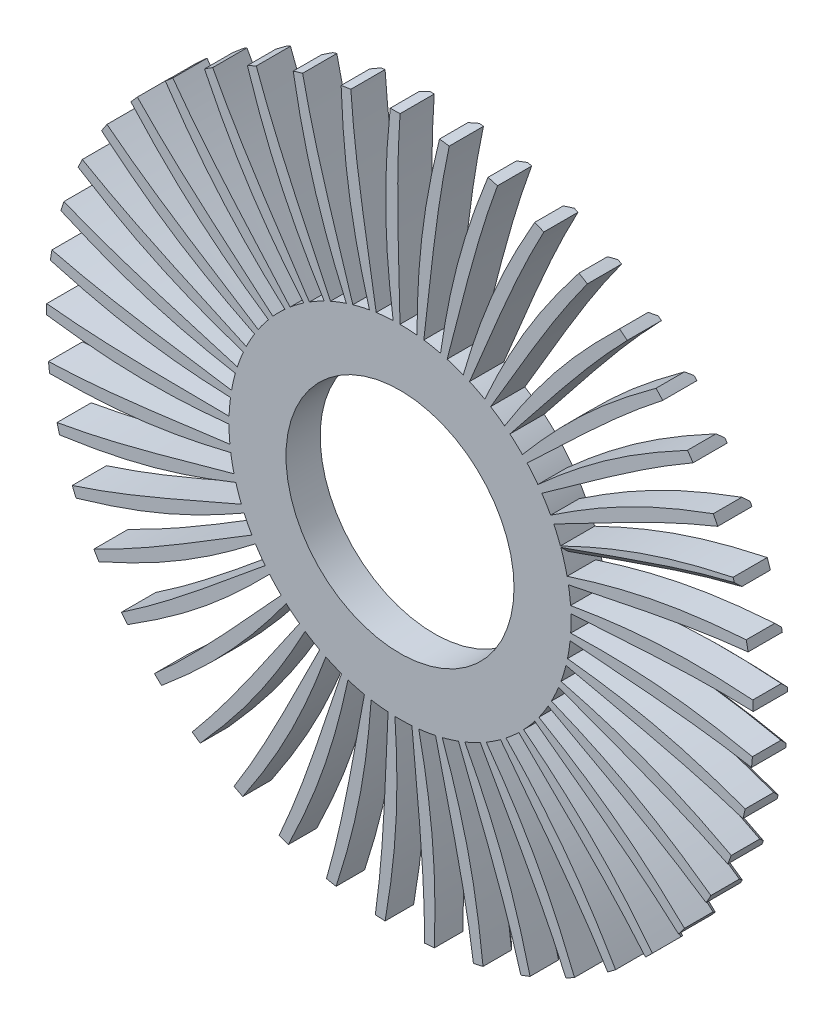
from build123d import *

# Parameters (mm, degrees)
BOSS_EXTRUDE1_DEPTH = 30
CHAMFER1_SIZE       = 5
SKETCH4_R           = 100
CUT_EXTRUDE4_DEPTH  = 30


with BuildPart() as part:
    # Sketch2 → Boss-Extrude1 (new body)
    with BuildSketch(Plane.XY):
        with BuildLine():
            ThreePointArc((-145.569699643, -273.695930817), (-141.749672317, -275.693725714), (-137.902233476, -277.638207029))
            add(Edge.make_bspline(
                [(-65.066689721, -135.152972179), (-87.040843165, -195.093671847), (-108.505576831, -233.805632242), (-137.902233476, -277.638207029)],
                knots=[0, 0, 0, 0, 0.636597092, 0.636597092, 0.636597092, 0.636597092], degree=3))
            ThreePointArc((-65.066689721, -135.152972179), (-58.257103372, -138.22485271), (-51.303021499, -140.953893118))
            add(Edge.make_bspline(
                [(-51.303021499, -140.953893118), (-68.971079254, -192.807719134), (-83.711324529, -241.446059466), (-106.06191392, -291.291727338)],
                knots=[0, 0, 0, 0, 0.656298971, 0.656298971, 0.656298971, 0.656298971], degree=3))
            ThreePointArc((-106.06191392, -291.291727338), (-102.001023527, -292.738434783), (-97.920408202, -294.128532546))
            add(Edge.make_bspline(
                [(-45.623806927, -142.893205722), (-59.041976374, -205.308777697), (-74.910153155, -246.631309501), (-97.920408202, -294.128532546)],
                knots=[0, 0, 0, 0, 0.636597092, 0.636597092, 0.636597092, 0.636597092], degree=3))
            ThreePointArc((-45.623806927, -142.893205722), (-38.452967865, -144.987479675), (-31.186753623, -146.72214011))
            add(Edge.make_bspline(
                [(-31.186753623, -146.72214011), (-41.46620929, -200.530246641), (-49.293854863, -250.746687633), (-64.489753687, -303.217861725)],
                knots=[0, 0, 0, 0, 0.656298971, 0.656298971, 0.656298971, 0.656298971], degree=3))
            ThreePointArc((-64.489753687, -303.217861725), (-60.267040839, -304.085323205), (-56.032673566, -304.893980743))
            add(Edge.make_bspline(
                [(-25.292908628, -147.852185554), (-29.893924672, -211.527781724), (-39.856688557, -254.656588858), (-56.032673566, -304.893980743)],
                knots=[0, 0, 0, 0, 0.636597092, 0.636597092, 0.636597092, 0.636597092], degree=3))
            ThreePointArc((-25.292908628, -147.852185554), (-17.900389078, -148.928090268), (-10.463471062, -149.634607539))
            add(Edge.make_bspline(
                [(-10.463471062, -149.634607539), (-13.154246731, -204.349680998), (-13.916936382, -255.166816745), (-21.662373755, -309.24220534)],
                knots=[0, 0, 0, 0, 0.656298971, 0.656298971, 0.656298971, 0.656298971], degree=3))
            ThreePointArc((-21.662373755, -309.24220534), (-17.360028754, -309.513536702), (-13.054326674, -309.725014416))
            add(Edge.make_bspline(
                [(-4.469712632, -149.933390774), (-0.164021731, -213.62963809), (-4.027458852, -257.725267381), (-13.054326674, -309.725014416)],
                knots=[0, 0, 0, 0, 0.636597092, 0.636597092, 0.636597092, 0.636597092], degree=3))
            ThreePointArc((-4.469712632, -149.933390774), (3.00060042, -149.969984987), (10.463471062, -149.634607539))
            add(Edge.make_bspline(
                [(10.463471062, -149.634607539), (15.413748279, -204.191681258), (21.730859434, -254.620414018), (21.586639642, -309.247501185)],
                knots=[0, 0, 0, 0, 0.656298971, 0.656298971, 0.656298971, 0.656298971], degree=3))
            ThreePointArc((21.586639642, -309.247501185), (25.884876545, -308.917421273), (30.178107837, -308.527602991))
            add(Edge.make_bspline(
                [(16.440481235, -149.096313089), (29.569073708, -211.57343655), (31.880160758, -255.777616733), (30.178107837, -308.527602991)],
                knots=[0, 0, 0, 0, 0.636597092, 0.636597092, 0.636597092, 0.636597092], degree=3))
            ThreePointArc((16.440481235, -149.096313089), (23.843186645, -148.092884537), (31.186753623, -146.72214011))
            add(Edge.make_bspline(
                [(31.186753623, -146.72214011), (43.681732211, -200.059322707), (56.955688791, -249.118114557), (64.415493653, -303.233646183)],
                knots=[0, 0, 0, 0, 0.656298971, 0.656298971, 0.656298971, 0.656298971], degree=3))
            ThreePointArc((64.415493653, -303.233646183), (68.625962165, -302.308579628), (72.823159806, -301.325052719))
            add(Edge.make_bspline(
                [(37.030679836, -145.357245264), (58.72664076, -205.399198729), (67.167269302, -248.851545718), (72.823159806, -301.325052719)],
                knots=[0, 0, 0, 0, 0.636597092, 0.636597092, 0.636597092, 0.636597092], degree=3))
            ThreePointArc((37.030679836, -145.357245264), (44.221692363, -143.333324543), (51.303021499, -140.953893118))
            add(Edge.make_bspline(
                [(51.303021499, -140.953893118), (71.099500913, -192.033037004), (91.071940451, -238.767014365), (105.990573352, -291.317693181)],
                knots=[0, 0, 0, 0, 0.656298971, 0.656298971, 0.656298971, 0.656298971], degree=3))
            ThreePointArc((105.990573352, -291.317693181), (110.031321492, -289.815645352), (114.050791804, -288.257553047))
            add(Edge.make_bspline(
                [(56.900118376, -138.788964002), (86.741160551, -195.227099143), (101.14704335, -237.08186243), (114.050791804, -288.257553047)],
                knots=[0, 0, 0, 0, 0.636597092, 0.636597092, 0.636597092, 0.636597092], degree=3))
            ThreePointArc((56.900118376, -138.788964002), (63.73947314, -135.783944426), (70.420734418, -132.442138929))
            add(Edge.make_bspline(
                [(70.420734418, -132.442138929), (97.133398704, -180.26904667), (123.415580383, -223.768585831), (145.502667102, -273.731572651)],
                knots=[0, 0, 0, 0, 0.656298971, 0.656298971, 0.656298971, 0.656298971], degree=3))
            ThreePointArc((145.502667102, -273.731572651), (149.295046306, -271.681779199), (153.058554871, -269.579447994))
            add(Edge.make_bspline(
                [(75.662060835, -129.519313426), (113.067362319, -181.255126139), (133.158105253, -220.697650366), (153.058554871, -269.579447994)],
                knots=[0, 0, 0, 0, 0.636597092, 0.636597092, 0.636597092, 0.636597092], degree=3))
            ThreePointArc((75.662060835, -129.519313426), (82.016637575, -125.591684282), (88.167787844, -121.352549156))
            add(Edge.make_bspline(
                [(88.167787844, -121.352549156), (121.276705377, -164.996324395), (153.357076426, -204.414756308), (182.182716945, -250.817578424)],
                knots=[0, 0, 0, 0, 0.656298971, 0.656298971, 0.656298971, 0.656298971], degree=3))
            ThreePointArc((182.182716945, -250.817578424), (185.652912863, -248.259936247), (189.087207269, -245.654285628))
            add(Edge.make_bspline(
                [(92.951327344, -117.728716739), (137.192836491, -163.75522828), (162.577396102, -200.017809578), (189.087207269, -245.654285628)],
                knots=[0, 0, 0, 0, 0.636597092, 0.636597092, 0.636597092, 0.636597092], degree=3))
            ThreePointArc((92.951327344, -117.728716739), (98.697441453, -112.954924862), (104.198755569, -107.900970051))
            add(Edge.make_bspline(
                [(104.198755569, -107.900970051), (143.05949893, -146.512136346), (180.313651418, -181.082226071), (215.316787432, -223.021705334)],
                knots=[0, 0, 0, 0, 0.656298971, 0.656298971, 0.656298971, 0.656298971], degree=3))
            ThreePointArc((215.316787432, -223.021705334), (218.397256649, -220.005996028), (221.435492261, -216.947742019))
            add(Edge.make_bspline(
                [(108.431401996, -103.646664496), (158.648008155, -143.068021171), (188.832302865, -175.444849643), (221.435492261, -216.947742019)],
                knots=[0, 0, 0, 0, 0.636597092, 0.636597092, 0.636597092, 0.636597092], degree=3))
            ThreePointArc((108.431401996, -103.646664496), (113.457211899, -98.119626314), (118.201613041, -92.349221299))
            add(Edge.make_bspline(
                [(118.201613041, -92.349221299), (162.057802065, -125.176256219), (203.760626288, -154.225136281), (244.25996157, -190.884968433)],
                knots=[0, 0, 0, 0, 0.656298971, 0.656298971, 0.656298971, 0.656298971], degree=3))
            ThreePointArc((244.25996157, -190.884968433), (246.890746257, -187.469889349), (249.473787275, -184.018557386))
            add(Edge.make_bspline(
                [(121.800982748, -87.547247825), (177.0152768, -119.596157768), (211.411803647, -147.457055275), (249.473787275, -184.018557386)],
                knots=[0, 0, 0, 0, 0.636597092, 0.636597092, 0.636597092, 0.636597092], degree=3))
            ThreePointArc((121.800982748, -87.547247825), (126.008666771, -81.37454085), (129.903810568, -75))
            add(Edge.make_bspline(
                [(129.903810568, -75), (177.90183442, -101.40396265), (223.241632342, -124.366229642), (268.448893399, -155.03287275)],
                knots=[0, 0, 0, 0, 0.656298971, 0.656298971, 0.656298971, 0.656298971], degree=3))
            ThreePointArc((268.448893399, -155.03287275), (270.578788324, -151.284894518), (272.656358792, -147.507660852))
            add(Edge.make_bspline(
                [(132.799845917, -69.743823558), (191.937144434, -93.796491192), (229.876414148, -116.599177057), (272.656358792, -147.507660852)],
                knots=[0, 0, 0, 0, 0.636597092, 0.636597092, 0.636597092, 0.636597092], degree=3))
            ThreePointArc((132.799845917, -69.743823558), (136.107506278, -63.04559251), (139.077578185, -56.190989012))
            add(Edge.make_bspline(
                [(139.077578185, -56.190989012), (190.283209928, -75.657956294), (238.377493956, -92.086675808), (287.412772873, -116.163238546)],
                knots=[0, 0, 0, 0, 0.656298971, 0.656298971, 0.656298971, 0.656298971], degree=3))
            ThreePointArc((287.412772873, -116.163238546), (289.000322054, -112.155311299), (290.531984428, -108.125695487))
            add(Edge.make_bspline(
                [(141.213911143, -50.582915098), (203.123173877, -66.171182608), (243.866741728, -83.471828486), (290.531984428, -108.125695487)],
                knots=[0, 0, 0, 0, 0.636597092, 0.636597092, 0.636597092, 0.636597092], degree=3))
            ThreePointArc((141.213911143, -50.582915098), (143.557167994, -43.489533425), (145.544358941, -36.28828434))
            add(Edge.make_bspline(
                [(145.544358941, -36.28828434), (198.960939199, -48.439353878), (248.873608801, -58.014759576), (300.782489651, -75.032619037)],
                knots=[0, 0, 0, 0, 0.656298971, 0.656298971, 0.656298971, 0.656298971], degree=3))
            ThreePointArc((300.782489651, -75.032619037), (301.796793249, -70.842752521), (302.752735461, -66.63918645))
            add(Edge.make_bspline(
                [(146.879408216, -30.437467733), (210.355641789, -37.257927222), (253.110480574, -48.719795722), (302.752735461, -66.63918645)],
                knots=[0, 0, 0, 0, 0.636597092, 0.636597092, 0.636597092, 0.636597092], degree=3))
            ThreePointArc((146.879408216, -30.437467733), (148.21265273, -23.08700004), (149.178284305, -15.67926949))
            add(Edge.make_bspline(
                [(149.178284305, -15.67926949), (203.766120103, -20.277934537), (254.525681941, -22.813652028), (308.297817404, -32.441574927)],
                knots=[0, 0, 0, 0, 0.656298971, 0.656298971, 0.656298971, 0.656298971], degree=3))
            ThreePointArc((308.297817404, -32.441574927), (308.719133153, -28.151320136), (309.080748875, -23.855621451))
            add(Edge.make_bspline(
                [(149.686064682, -9.699589681), (213.49377641, -7.619488663), (257.427711825, -13.019487551), (309.080748875, -23.855621451)],
                knots=[0, 0, 0, 0, 0.636597092, 0.636597092, 0.636597092, 0.636597092], degree=3))
            ThreePointArc((149.686064682, -9.699589681), (149.983346769, -2.235104461), (149.908624053, 5.234924505))
            add(Edge.make_bspline(
                [(149.908624053, 5.234924505), (204.60522526, 8.278171733), (255.223702198, 12.831497295), (309.812478821, 10.780907518)],
                knots=[0, 0, 0, 0, 0.656298971, 0.656298971, 0.656298971, 0.656298971], degree=3))
            ThreePointArc((309.812478821, 10.780907518), (309.63260629, 15.088045663), (309.392857086, 19.392266086))
            add(Edge.make_bspline(
                [(149.579252164, 11.227079851), (212.476497519, 22.167254576), (256.734405485, 22.934230134), (309.392857086, 19.392266086)],
                knots=[0, 0, 0, 0, 0.636597092, 0.636597092, 0.636597092, 0.636597092], degree=3))
            ThreePointArc((149.579252164, 11.227079851), (148.834785567, 18.660294884), (147.721162952, 26.04722665))
            add(Edge.make_bspline(
                [(147.721162952, 26.04722665), (201.461922442, 36.673152807), (250.954083404, 48.226896119), (305.296992744, 53.79355186)],
                knots=[0, 0, 0, 0, 0.656298971, 0.656298971, 0.656298971, 0.656298971], degree=3))
            ThreePointArc((305.296992744, 53.79355186), (304.519432948, 58.033739815), (303.682985264, 62.262705221))
            add(Edge.make_bspline(
                [(146.561049647, 31.935227045), (207.323605292, 51.522537419), (251.044055973, 58.441559118), (303.682985264, 62.262705221)],
                knots=[0, 0, 0, 0, 0.636597092, 0.636597092, 0.636597092, 0.636597092], degree=3))
            ThreePointArc((146.561049647, 31.935227045), (144.789324561, 39.192492815), (142.658477444, 46.352549156))
            add(Edge.make_bspline(
                [(142.658477444, 46.352549156), (194.397392464, 64.354332676), (241.799928833, 82.683613267), (294.839247972, 95.759165907)],
                knots=[0, 0, 0, 0, 0.656298971, 0.656298971, 0.656298971, 0.656298971], degree=3))
            ThreePointArc((294.839247972, 95.759165907), (293.479135229, 99.849873235), (292.062269567, 103.921271621))
            add(Edge.make_bspline(
                [(140.690203009, 52.02179137), (198.135394915, 79.874992677), (240.46741947, 92.811389629), (292.062269567, 103.921271621)],
                knots=[0, 0, 0, 0, 0.636597092, 0.636597092, 0.636597092, 0.636597092], degree=3))
            ThreePointArc((140.690203009, 52.02179137), (137.925704048, 58.961853455), (134.819106945, 65.755672018))
            add(Edge.make_bspline(
                [(134.819106945, 65.755672018), (183.549138365, 90.782928662), (227.93941369, 115.530987935), (278.642792614, 135.860936712)],
                knots=[0, 0, 0, 0, 0.656298971, 0.656298971, 0.656298971, 0.656298971], degree=3))
            ThreePointArc((278.642792614, 135.860936712), (276.726599971, 139.72254245), (274.756894009, 143.557128679))
            add(Edge.make_bspline(
                [(132.080981602, 71.0958107), (185.090704452, 106.672772059), (225.210358175, 125.374752013), (274.756894009, 143.557128679)],
                knots=[0, 0, 0, 0, 0.636597092, 0.636597092, 0.636597092, 0.636597092], degree=3))
            ThreePointArc((132.080981602, 71.0958107), (128.377516594, 77.583588684), (124.355635883, 83.878935521))
            add(Edge.make_bspline(
                [(124.355635883, 83.878935521), (169.128309071, 115.444538206), (209.642317137, 146.129683336), (257.022872249, 173.318328924)],
                knots=[0, 0, 0, 0, 0.656298971, 0.656298971, 0.656298971, 0.656298971], degree=3))
            ThreePointArc((257.022872249, 173.318328924), (254.587896216, 176.875671308), (252.103688041, 180.39880952))
            add(Edge.make_bspline(
                [(120.900954128, 88.786030945), (168.443433964, 131.394287272), (205.569833431, 155.49783746), (252.103688041, 180.39880952)],
                knots=[0, 0, 0, 0, 0.636597092, 0.636597092, 0.636597092, 0.636597092], degree=3))
            ThreePointArc((120.900954128, 88.786030945), (116.330606807, 94.69524761), (111.471723822, 100.369590954))
            add(Edge.make_bspline(
                [(111.471723822, 100.369590954), (151.415589623, 137.85915113), (187.264771345, 173.884130672), (230.400294035, 207.40227701)],
                knots=[0, 0, 0, 0, 0.656298971, 0.656298971, 0.656298971, 0.656298971], degree=3))
            ThreePointArc((230.400294035, 207.40227701), (227.49392865, 210.586116417), (224.543570548, 213.729232735))
            add(Edge.make_bspline(
                [(107.367727105, 104.74813209), (148.517603636, 153.558362142), (181.928125711, 182.594334378), (224.543570548, 213.729232735)],
                knots=[0, 0, 0, 0, 0.636597092, 0.636597092, 0.636597092, 0.636597092], degree=3))
            ThreePointArc((107.367727105, 104.74813209), (102.019454082, 109.963771256), (96.418141453, 114.906666468))
            add(Edge.make_bspline(
                [(96.418141453, 114.906666468), (130.755737954, 157.590492489), (161.242329789, 198.254121194), (199.293236172, 237.449375691)],
                knots=[0, 0, 0, 0, 0.656298971, 0.656298971, 0.656298971, 0.656298971], degree=3))
            ThreePointArc((199.293236172, 237.449375691), (195.972050533, 240.197742308), (192.61296787, 242.899659548))
            add(Edge.make_bspline(
                [(91.744709403, 118.671429993), (125.701047089, 172.733598162), (154.745393965, 206.136840274), (192.61296787, 242.899659548)],
                knots=[0, 0, 0, 0, 0.636597092, 0.636597092, 0.636597092, 0.636597092], degree=3))
            ThreePointArc((91.744709403, 118.671429993), (85.722608729, 123.091975176), (79.487889635, 127.207214423))
            add(Edge.make_bspline(
                [(79.487889635, 127.207214423), (107.55087458, 174.254514168), (132.081489694, 218.765320758), (164.307162161, 262.874792368)],
                knots=[0, 0, 0, 0, 0.656298971, 0.656298971, 0.656298971, 0.656298971], degree=3))
            ThreePointArc((164.307162161, 262.874792368), (160.635799368, 265.134192366), (156.933372865, 267.342320782))
            add(Edge.make_bspline(
                [(74.33598529, 130.284923498), (100.437862644, 188.546771176), (124.550719145, 225.667127052), (156.933372865, 267.342320782)],
                knots=[0, 0, 0, 0, 0.636597092, 0.636597092, 0.636597092, 0.636597092], degree=3))
            ThreePointArc((74.33598529, 130.284923498), (67.757270305, 133.824333814), (61.010496461, 137.031818646))
            add(Edge.make_bspline(
                [(61.010496461, 137.031818646), (82.252655768, 187.526869941), (100.349833643, 235.018502195), (126.123036135, 283.183650227)],
                knots=[0, 0, 0, 0, 0.656298971, 0.656298971, 0.656298971, 0.656298971], degree=3))
            ThreePointArc((126.123036135, 283.183650227), (122.172955088, 284.910106955), (118.199248267, 286.58146784))
            add(Edge.make_bspline(
                [(55.480395779, 139.362569165), (73.219769448, 200.690095758), (91.931806252, 240.805059895), (118.199248267, 286.58146784)],
                knots=[0, 0, 0, 0, 0.636597092, 0.636597092, 0.636597092, 0.636597092], degree=3))
            ThreePointArc((55.480395779, 139.362569165), (48.473113687, 141.951954018), (41.345603373, 144.189254391))
            add(Edge.make_bspline(
                [(41.345603373, 144.189254391), (55.353482573, 197.149228499), (66.664982227, 246.697315817), (85.484068673, 297.980660452)],
                knots=[0, 0, 0, 0, 0.656298971, 0.656298971, 0.656298971, 0.656298971], degree=3))
            ThreePointArc((85.484068673, 297.980660452), (81.332153208, 299.140570392), (77.164509751, 300.242632607))
            add(Edge.make_bspline(
                [(35.544943473, 145.727680945), (44.576536726, 208.927215908), (57.52354532, 251.255996158), (77.164509751, 300.242632607)],
                knots=[0, 0, 0, 0, 0.636597092, 0.636597092, 0.636597092, 0.636597092], degree=3))
            ThreePointArc((35.544943473, 145.727680945), (28.245483049, 147.316640904), (20.875965144, 148.540210311))
            add(Edge.make_bspline(
                [(20.875965144, 148.540210311), (27.376916804, 202.934301579), (31.682572762, 253.574446799), (43.181251052, 306.977816068)],
                knots=[0, 0, 0, 0, 0.656298971, 0.656298971, 0.656298971, 0.656298971], degree=3))
            ThreePointArc((43.181251052, 306.977816068), (38.908313479, 307.548602894), (34.627851827, 308.059916052))
            add(Edge.make_bspline(
                [(14.917649274, 149.256369178), (15.065672422, 213.097805451), (21.995654011, 256.816520256), (34.627851827, 308.059916052)],
                knots=[0, 0, 0, 0, 0.636597092, 0.636597092, 0.636597092, 0.636597092], degree=3))
            ThreePointArc((14.917649274, 149.256369178), (7.468086212, 149.813976946), (0, 150))
            add(Edge.make_bspline(
                [(0, 150), (-1.13250951, 204.769489312), (-3.916501944, 255.516039612), (0.037959496, 309.999997676)],
                knots=[0, 0, 0, 0, 0.656298971, 0.656298971, 0.656298971, 0.656298971], degree=3))
            ThreePointArc((0.037959496, 309.999997676), (-4.272832314, 309.970551672), (-8.582797845, 309.881163644))
            add(Edge.make_bspline(
                [(-6, 149.879951962), (-14.738428058, 213.120688606), (-13.960357683, 257.378402911), (-8.582797845, 309.881163644)],
                knots=[0, 0, 0, 0, 0.636597092, 0.636597092, 0.636597092, 0.636597092], degree=3))
            ThreePointArc((-6, 149.879951962), (-13.454668429, 149.395354337), (-20.875965144, 148.540210311))
            add(Edge.make_bspline(
                [(-20.875965144, 148.540210311), (-29.619892815, 202.619071858), (-39.439346395, 252.484303358), (-43.106070898, 306.988381949)],
                knots=[0, 0, 0, 0, 0.656298971, 0.656298971, 0.656298971, 0.656298971], degree=3))
            ThreePointArc((-43.106070898, 306.988381949), (-47.370812287, 306.359276248), (-51.62639312, 305.67092687))
            add(Edge.make_bspline(
                [(-26.800866099, 147.586291966), (-44.255661802, 208.995419978), (-49.644646895, 252.930707717), (-51.62639312, 305.67092687)],
                knots=[0, 0, 0, 0, 0.636597092, 0.636597092, 0.636597092, 0.636597092], degree=3))
            ThreePointArc((-26.800866099, 147.586291966), (-34.115543253, 146.068921091), (-41.345603373, 144.189254391))
            add(Edge.make_bspline(
                [(-41.345603373, 144.189254391), (-57.530758598, 196.524904646), (-74.194548829, 244.538247337), (-85.411090654, 298.001586562)],
                knots=[0, 0, 0, 0, 0.656298971, 0.656298971, 0.656298971, 0.656298971], degree=3))
            ThreePointArc((-85.411090654, 298.001586562), (-89.546773281, 296.78506599), (-93.665139377, 295.5111532))
            add(Edge.make_bspline(
                [(-47.080083824, 142.420032675), (-72.911509428, 200.80229323), (-84.362659526, 243.560004002), (-93.665139377, 295.5111532)],
                knots=[0, 0, 0, 0, 0.636597092, 0.636597092, 0.636597092, 0.636597092], degree=3))
            ThreePointArc((-47.080083824, 142.420032675), (-54.112397833, 139.899422446), (-61.010496461, 137.031818646))
            add(Edge.make_bspline(
                [(-61.010496461, 137.031818646), (-84.321853606, 186.605603708), (-107.505638761, 231.83253249), (-126.053680677, 283.214529267)],
                knots=[0, 0, 0, 0, 0.656298971, 0.656298971, 0.656298971, 0.656298971], degree=3))
            ThreePointArc((-126.053680677, 283.214529267), (-129.979808188, 281.434272013), (-133.880800238, 279.599591072))
            add(Edge.make_bspline(
                [(-66.442941271, 134.481729448), (-100.148217459, 188.700778253), (-117.438648949, 229.448681854), (-133.880800238, 279.599591072)],
                knots=[0, 0, 0, 0, 0.636597092, 0.636597092, 0.636597092, 0.636597092], degree=3))
            ThreePointArc((-66.442941271, 134.481729448), (-73.056016141, 131.006940677), (-79.487889635, 127.207214423))
            add(Edge.make_bspline(
                [(-79.487889635, 127.207214423), (-109.471719648, 173.054236956), (-138.724253729, 214.614461101), (-164.242779203, 262.915023305)],
                knots=[0, 0, 0, 0, 0.656298971, 0.656298971, 0.656298971, 0.656298971], degree=3))
            ThreePointArc((-164.242779203, 262.915023305), (-167.882933986, 260.605680054), (-171.49062361, 258.245940943))
            add(Edge.make_bspline(
                [(-84.512562444, 123.925892328), (-125.435654354, 172.926417271), (-148.228828655, 210.871402108), (-171.49062361, 258.245940943)],
                knots=[0, 0, 0, 0, 0.636597092, 0.636597092, 0.636597092, 0.636597092], degree=3))
            ThreePointArc((-84.512562444, 123.925892328), (-90.577682196, 119.564557826), (-96.418141453, 114.906666468))
            add(Edge.make_bspline(
                [(-96.418141453, 114.906666468), (-132.490843189, 156.134566327), (-167.24275889, 193.219163349), (-199.235078849, 237.49817548)],
                knots=[0, 0, 0, 0, 0.656298971, 0.656298971, 0.656298971, 0.656298971], degree=3))
            ThreePointArc((-199.235078849, 237.49817548), (-202.518409434, 234.704694969), (-205.762577061, 231.865827325))
            add(Edge.make_bspline(
                [(-100.93724272, 110.957978677), (-148.281628918, 153.786240278), (-176.133902819, 188.189750383), (-205.762577061, 231.865827325)],
                knots=[0, 0, 0, 0, 0.636597092, 0.636597092, 0.636597092, 0.636597092], degree=3))
            ThreePointArc((-100.93724272, 110.957978677), (-106.336356696, 105.794986859), (-111.471723822, 100.369590954))
            add(Edge.make_bspline(
                [(-111.471723822, 100.369590954), (-152.931183173, 136.175913965), (-192.506073985, 168.063074366), (-230.349494311, 207.458695819)],
                knots=[0, 0, 0, 0, 0.656298971, 0.656298971, 0.656298971, 0.656298971], degree=3))
            ThreePointArc((-230.349494311, 207.458695819), (-233.212094403, 204.235449969), (-236.029596001, 200.972709121))
            add(Edge.make_bspline(
                [(-115.397294381, 95.830394184), (-168.241470243, 131.652789047), (-200.610730915, 161.845199229), (-236.029596001, 200.972709121)],
                knots=[0, 0, 0, 0, 0.636597092, 0.636597092, 0.636597092, 0.636597092], degree=3))
            ThreePointArc((-115.397294381, 95.830394184), (-120.02531497, 89.966236813), (-124.355635883, 83.878935521))
            add(Edge.make_bspline(
                [(-124.355635883, 83.878935521), (-170.394891634, 113.566752335), (-214.022477323, 139.635828809), (-256.980418885, 173.381268624)],
                knots=[0, 0, 0, 0, 0.656298971, 0.656298971, 0.656298971, 0.656298971], degree=3))
            ThreePointArc((-256.980418885, 173.381268624), (-259.36657123, 169.79099425), (-261.702567335, 166.167885737))
            add(Edge.make_bspline(
                [(-127.61126897, 78.837580074), (-184.926682722, 106.95686603), (-221.182899324, 132.350515369), (-261.702567335, 166.167885737)],
                knots=[0, 0, 0, 0, 0.636597092, 0.636597092, 0.636597092, 0.636597092], degree=3))
            ThreePointArc((-127.61126897, 78.837580074), (-131.378117014, 72.386396303), (-134.819106945, 65.755672018))
            add(Edge.make_bspline(
                [(-134.819106945, 65.755672018), (-184.54205735, 88.747143052), (-231.373176584, 108.490730681), (-278.609511913, 135.929172261)],
                knots=[0, 0, 0, 0, 0.656298971, 0.656298971, 0.656298971, 0.656298971], degree=3))
            ThreePointArc((-278.609511913, 135.929172261), (-280.472772771, 132.041749966), (-282.281795877, 128.128793471))
            add(Edge.make_bspline(
                [(-137.341435363, 60.310282144), (-198.012507672, 80.179149278), (-237.44999419, 100.279779273), (-282.281795877, 128.128793471)],
                knots=[0, 0, 0, 0, 0.636597092, 0.636597092, 0.636597092, 0.636597092], degree=3))
            ThreePointArc((-137.341435363, 60.310282144), (-140.173793452, 53.397636927), (-142.658477444, 46.352549156))
            add(Edge.make_bspline(
                [(-142.658477444, 46.352549156), (-195.097321833, 62.200171577), (-244.220460149, 75.233983884), (-294.81578771, 95.831369171)],
                knots=[0, 0, 0, 0, 0.656298971, 0.656298971, 0.656298971, 0.656298971], degree=3))
            ThreePointArc((-294.81578771, 95.831369171), (-296.119890826, 91.72246321), (-297.366730354, 87.595819984))
            add(Edge.make_bspline(
                [(-144.398406941, 40.609113174), (-207.244244396, 51.840836587), (-249.095395014, 66.25721134), (-297.366730354, 87.595819984)],
                knots=[0, 0, 0, 0, 0.636597092, 0.636597092, 0.636597092, 0.636597092], degree=3))
            ThreePointArc((-144.398406941, 40.609113174), (-146.241146445, 33.369553287), (-147.721162952, 26.04722665))
            add(Edge.make_bspline(
                [(-147.721162952, 26.04722665), (-201.855238867, 34.442544515), (-252.314270255, 40.512893158), (-305.283809549, 53.86831747)],
                knots=[0, 0, 0, 0, 0.656298971, 0.656298971, 0.656298971, 0.656298971], degree=3))
            ThreePointArc((-305.283809549, 53.86831747), (-306.003372038, 49.617903033), (-306.663759674, 45.357893499))
            add(Edge.make_bspline(
                [(-148.644827779, 20.117534009), (-212.44220764, 22.49350098), (-255.892437316, 30.945022154), (-306.663759674, 45.357893499)],
                knots=[0, 0, 0, 0, 0.636597092, 0.636597092, 0.636597092, 0.636597092], degree=3))
            ThreePointArc((-148.644827779, 20.117534009), (-149.462081869, 12.69196925), (-149.908624053, 5.234924505))
            add(Edge.make_bspline(
                [(-149.908624053, 5.234924505), (-204.684273284, 6.014532501), (-255.49707009, 5.003265081), (-309.809829285, 10.856780296)],
                knots=[0, 0, 0, 0, 0.656298971, 0.656298971, 0.656298971, 0.656298971], degree=3))
            ThreePointArc((-309.809829285, 10.856780296), (-309.930845684, 6.547586839), (-309.991927737, 2.237127212))
            add(Edge.make_bspline(
                [(-149.998046125, -0.765610073), (-213.505224962, -7.291645037), (-257.708824399, -4.969476687), (-309.991927737, 2.237127212)],
                knots=[0, 0, 0, 0, 0.636597092, 0.636597092, 0.636597092, 0.636597092], degree=3))
            ThreePointArc((-149.998046125, -0.765610073), (-149.77390788, -8.232649532), (-149.178284305, -15.67926949))
            add(Edge.make_bspline(
                [(-149.178284305, -15.67926949), (-203.529361145, -22.530545547), (-253.706910082, -30.603745903), (-308.3057531, -32.36607183)],
                knots=[0, 0, 0, 0, 0.656298971, 0.656298971, 0.656298971, 0.656298971], degree=3))
            ThreePointArc((-308.3057531, -32.36607183), (-307.825867961, -36.650170721), (-307.286455536, -40.927182212))
            add(Edge.make_bspline(
                [(-148.431723123, -21.633852425), (-210.412605938, -36.934867478), (-254.509202355, -40.787250318), (-307.286455536, -40.927182212)],
                knots=[0, 0, 0, 0, 0.636597092, 0.636597092, 0.636597092, 0.636597092], degree=3))
            ThreePointArc((-148.431723123, -21.633852425), (-147.17055514, -28.997029155), (-145.544358941, -36.28828434))
            add(Edge.make_bspline(
                [(-145.544358941, -36.28828434), (-198.412981504, -50.637092153), (-246.97863366, -65.615089742), (-300.80085613, -74.95895511)],
                knots=[0, 0, 0, 0, 0.656298971, 0.656298971, 0.656298971, 0.656298971], degree=3))
            ThreePointArc((-300.80085613, -74.95895511), (-299.729409869, -79.134574361), (-298.600002013, -83.294890588))
            add(Edge.make_bspline(
                [(-143.976345469, -42.081016449), (-203.224544881, -65.859194736), (-246.355848187, -75.811146515), (-298.600002013, -83.294890588)],
                knots=[0, 0, 0, 0, 0.636597092, 0.636597092, 0.636597092, 0.636597092], degree=3))
            ThreePointArc((-143.976345469, -42.081016449), (-141.702694948, -49.19701459), (-139.077578185, -56.190989012))
            add(Edge.make_bspline(
                [(-139.077578185, -56.190989012), (-189.434718869, -77.75804536), (-235.443199066, -99.349310516), (-287.441212649, -116.092847631)],
                knots=[0, 0, 0, 0, 0.656298971, 0.656298971, 0.656298971, 0.656298971], degree=3))
            ThreePointArc((-287.441212649, -116.092847631), (-285.79905975, -120.078713544), (-284.101639102, -124.041358666))
            add(Edge.make_bspline(
                [(-136.718632022, -61.709121353), (-192.080949222, -93.501647683), (-233.407457659, -109.35946498), (-284.101639102, -124.041358666)],
                knots=[0, 0, 0, 0, 0.636597092, 0.636597092, 0.636597092, 0.636597092], degree=3))
            ThreePointArc((-136.718632022, -61.709121353), (-133.476752983, -68.439436096), (-129.903810568, -75))
            add(Edge.make_bspline(
                [(-129.903810568, -75), (-176.769324909, -103.365526662), (-219.325130414, -131.14980997), (-268.486852922, -154.967124926)],
                knots=[0, 0, 0, 0, 0.656298971, 0.656298971, 0.656298971, 0.656298971], degree=3))
            ThreePointArc((-268.486852922, -154.967124926), (-266.305956023, -158.685657155), (-264.073560947, -162.373502791))
            add(Edge.make_bspline(
                [(-126.799845917, -80.136128403), (-177.198716375, -119.324197413), (-215.916056465, -140.779225854), (-264.073560947, -162.373502791)],
                knots=[0, 0, 0, 0, 0.636597092, 0.636597092, 0.636597092, 0.636597092], degree=3))
            ThreePointArc((-126.799845917, -80.136128403), (-122.652837849, -86.349761827), (-118.201613041, -92.349221299))
            add(Edge.make_bspline(
                [(-118.201613041, -92.349221299), (-160.663317113, -126.961115564), (-198.938147578, -160.397627553), (-244.306702003, -190.825143407)],
                knots=[0, 0, 0, 0, 0.656298971, 0.656298971, 0.656298971, 0.656298971], degree=3))
            ThreePointArc((-244.306702003, -190.825143407), (-241.629509781, -194.203964951), (-238.905591307, -197.545231383))
            add(Edge.make_bspline(
                [(-114.413045044, -97.003376868), (-158.867512075, -142.824237371), (-194.222094833, -169.458879231), (-238.905591307, -197.545231383)],
                knots=[0, 0, 0, 0, 0.636597092, 0.636597092, 0.636597092, 0.636597092], degree=3))
            ThreePointArc((-114.413045044, -97.003376868), (-109.441624742, -102.579387666), (-104.198755569, -107.900970051))
            add(Edge.make_bspline(
                [(-104.198755569, -107.900970051), (-141.4301806, -148.085550768), (-174.679059988, -186.523487765), (-215.371399024, -222.968967532)],
                knots=[0, 0, 0, 0, 0.656298971, 0.656298971, 0.656298971, 0.656298971], degree=3))
            ThreePointArc((-215.371399024, -222.968967532), (-212.250019981, -225.942313474), (-209.087596084, -228.871966749))
            add(Edge.make_bspline(
                [(-99.799324392, -111.982564942), (-137.444132361, -163.544366008), (-168.74782105, -194.84020828), (-209.087596084, -228.871966749)],
                knots=[0, 0, 0, 0, 0.636597092, 0.636597092, 0.636597092, 0.636597092], degree=3))
            ThreePointArc((-99.799324392, -111.982564942), (-94.100254897, -116.812422406), (-88.167787844, -121.352549156))
            add(Edge.make_bspline(
                [(-88.167787844, -121.352549156), (-119.444266497, -166.327669171), (-147.02004319, -209.018880455), (-182.244136744, -250.772954328)],
                knots=[0, 0, 0, 0, 0.656298971, 0.656298971, 0.656298971, 0.656298971], degree=3))
            ThreePointArc((-182.244136744, -250.772954328), (-178.739324973, -253.282951871), (-175.199948637, -255.743969621))
            add(Edge.make_bspline(
                [(-83.243123411, -124.782139767), (-113.345558951, -181.08128959), (-139.989062877, -216.429194302), (-175.199948637, -255.743969621)],
                knots=[0, 0, 0, 0, 0.636597092, 0.636597092, 0.636597092, 0.636597092], degree=3))
            ThreePointArc((-83.243123411, -124.782139767), (-76.927330628, -128.771836216), (-70.420734418, -132.442138929))
            add(Edge.make_bspline(
                [(-70.420734418, -132.442138929), (-95.133505612, -181.332408689), (-116.499448484, -227.445958393), (-145.569699643, -273.695930817)],
                knots=[0, 0, 0, 0, 0.656298971, 0.656298971, 0.656298971, 0.656298971], degree=3))
        make_face()
    extrude(amount=BOSS_EXTRUDE1_DEPTH)

    # Chamfer1
    chamfer1_edges = [part.edges().sort_by_distance(p)[0] for p in [
        (-197.51761662, 118.109289645, 0),
        (-212.033024845, 89.470718958, 0),
        (-222.421451425, 59.090702498, 0),
        (-228.480697454, 27.560552728, 0),
        (-230.0928266, -4.506031851, 0),
        (-227.226460603, -36.484911645, 0),
        (-219.937390016, -67.753654135, 0),
        (-208.367488308, -97.703648816, 0),
        (-192.741950455, -125.751953109, 0),
        (-173.364909776, -151.352638676, 0),
        (-150.613518329, -174.007417292, 0),
        (-124.930606067, -193.27533946, 0),
        (-96.816061665, -208.781376994, 0),
        (-66.817102749, -220.22372251, 0),
        (-35.517624932, -227.379663768, 0),
        (-3.526836946, -230.109918511, 0),
        (28.53259691, -228.361345436, 0),
        (60.036676222, -222.16797853, 0),
        (90.372209922, -211.650364634, 0),
        (118.948751353, -197.013217139, 0),
        (145.210090641, -178.541431472, 0),
        (168.645080688, -156.594539929, 0),
        (188.797586071, -131.59971379, 0),
        (205.275361195, -104.043448914, 0),
        (217.757684911, -74.462096653, 0),
        (226.001602986, -43.43142438, 0),
        (229.846656931, -11.555408834, 0),
        (229.218007146, 20.545519601, 0),
        (224.127889584, 52.246552867, 0),
        (218.171851087, 72.872863633, 30),
        (201.044453566, 112.000628866, 0),
        (183.500427935, 138.890626478, 0),
        (162.384775203, 163.077276032, 0),
        (-179.157752661, 144.448997357, 0),
        (-157.310786835, 167.977169643, 0),
        (-132.401945482, 188.235857393, 0),
        (-104.916050864, 204.830748294, 0),
        (-75.388084657, 217.438841672, 0),
        (-44.392775135, 225.814735329, 0),
        (-12.533410741, 229.795402023, 0),
        (19.569902237, 229.303362606, 0),
        (51.292309328, 224.348194064, 0),
        (82.016369962, 215.026343117, 0),
        (111.144075247, 201.51924899, 0),
        (138.108487532, 184.089811906, 0),
    ]]
    chamfer(chamfer1_edges, length=CHAMFER1_SIZE)

    # Sketch4 → Cut-Extrude4 (cut)
    with BuildSketch(Plane.XY.offset(30)):
        Circle(SKETCH4_R)
    extrude(amount=-CUT_EXTRUDE4_DEPTH, mode=Mode.SUBTRACT)


solid = part.part
